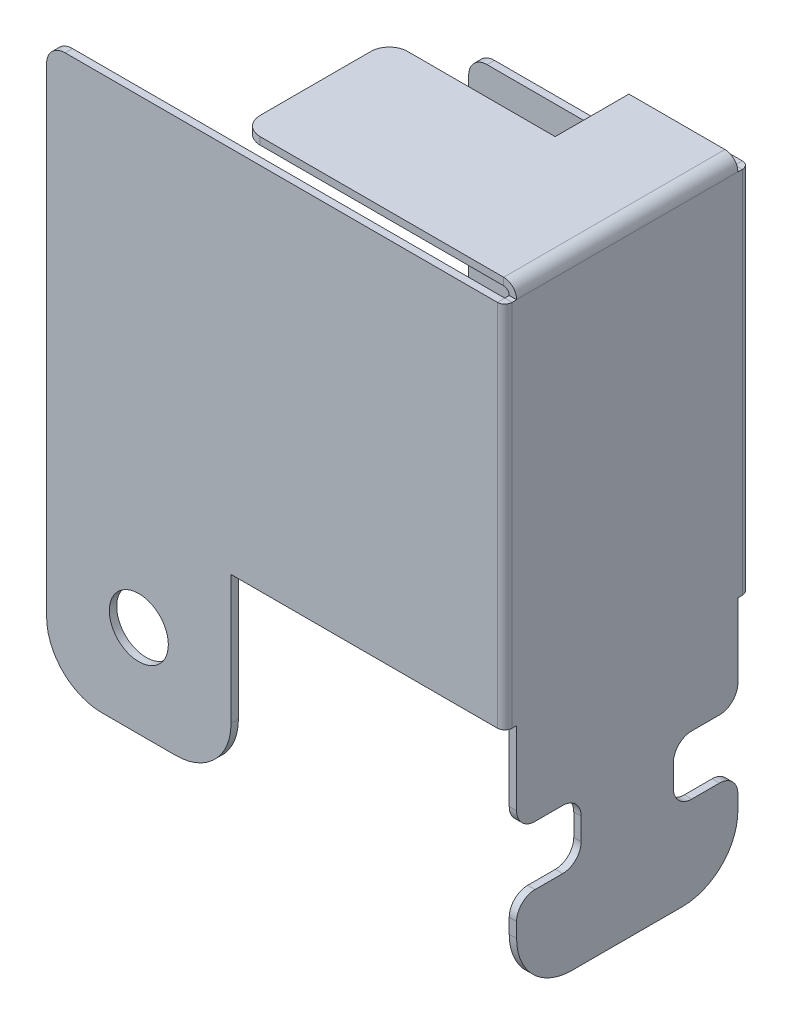
from build123d import *

# Parameters (mm, degrees)
SKETCH1_R                   = 1.6
BASE_FLANGE1_DEPTH          = 0.4
SKETCHED_START              = 45.702497433
SKETCHED_BEND8_DEPTH        = 12
SKETCHED_BEND8_2_DEPTH      = 8
SKETCHED_START_2            = 53.702497433
SKETCHED_BEND8_3_DEPTH      = 4
SKETCHED_START_3            = -4.042672779
SKETCHED_BEND12_DEPTH       = 33.707300919
SKETCHED_START_4            = 8.957327221
SKETCHED_BEND12_2_DEPTH     = 18
SKETCHED_START_5            = 3.957327221
SKETCHED_BEND12_3_OUTLINE_W = 0.4
SKETCHED_BEND12_3_OUTLINE_H = 12
SKETCHED_BEND12_3_DEPTH     = 25.007300919
SKETCHED_BEND12_4_OUTLINE_W = 0.4
SKETCHED_BEND12_4_OUTLINE_H = 12
SKETCHED_BEND12_4_DEPTH     = 4.8
SKETCHED_START_6            = 0.757327221
SKETCHED_BEND12_5_OUTLINE_W = 0.4
SKETCHED_BEND12_5_OUTLINE_H = 5
SKETCHED_BEND12_5_DEPTH     = 3.2
SKETCHED_START_7            = 26.957327221
SKETCHED_BEND12_6_DEPTH     = 2
SKETCHED_START_8            = -8.643134969
SKETCHED_BEND12_7_DEPTH     = 8
SKETCHED_START_9            = -12.643134969
SKETCHED_BEND12_8_DEPTH     = 4
FILLET1_R                   = 3
FILLET2_R                   = 1
FILLET3_R                   = 1


with BuildPart() as part:
    # Base-Flange1: sheet metal written as solids
    # Sketch1 → Base-Flange1 (new body)
    with BuildSketch(Plane.XY):
        Polygon((30.702497433, -1.042672779), (30.702497433, 8.957327221), (45.702497433, 8.957327221), (45.702497433, 3.957327221), (49.202497433, 3.957327221), (49.202497433, 0.757327221), (45.702497433, 0.757327221), (45.702497433, -4.042672779), (57.702497433, -4.042672779), (57.702497433, 0.757327221), (54.202497433, 0.757327221), (54.202497433, 3.957327221), (57.702497433, 3.957327221), (57.702497433, 8.957327221), (72.702497433, 8.957327221), (72.702497433, 26.957327221), (63.702497433, 26.957327221), (63.702497433, 28.957327221), (57.702497433, 28.957327221), (57.702497433, 34.957327221), (53.702497433, 34.957327221), (53.702497433, 43.957327221), (45.702497433, 43.957327221), (45.702497433, 28.957327221), (20.702497433, 28.957327221), (20.702497433, -1.042672779), align=None)
        with Locations((25.702497433, 3.957327221)):
            Circle(SKETCH1_R, mode=Mode.SUBTRACT)
    extrude(amount=-BASE_FLANGE1_DEPTH)

    # Sketched Bend8: read off the stored shape, not the designer's step
    # Sketched Bend8 outline → Sketched Bend8 (cut)
    with BuildSketch(Plane.YZ.offset(SKETCHED_START)):
        with BuildLine():
            ThreePointArc((28.96462814, 0), (29.338793878, -0.108392022), (29.597083672, -0.4))
            Line((29.597083672, -0.4), (43.957327221, -0.4))
            Line((43.957327221, -0.4), (43.957327221, 0))
            Line((43.957327221, 0), (28.96462814, 0))
        make_face()
    extrude(amount=SKETCHED_BEND8_DEPTH, mode=Mode.SUBTRACT)

    # Sketched Bend8 2 outline → Sketched Bend8 2 (add)
    with BuildSketch(Plane.YZ.offset(SKETCHED_START)):
        with BuildLine():
            Line((29.26462814, -14.907300918), (29.66462814, -14.907300918))
            Line((29.66462814, -14.907300918), (29.66462814, -0.7))
            ThreePointArc((29.66462814, -0.7), (29.647533284, -0.546245118), (29.597083672, -0.4))
            Line((29.597083672, -0.4), (28.96462814, -0.4))
            ThreePointArc((28.96462814, -0.4), (29.176760174, -0.487867966), (29.26462814, -0.7))
            Line((29.26462814, -0.7), (29.26462814, -14.907300918))
        make_face()
    extrude(amount=SKETCHED_BEND8_2_DEPTH)

    # Sketched Bend8 3 outline → Sketched Bend8 3 (add)
    with BuildSketch(Plane.YZ.offset(SKETCHED_START_2)):
        with BuildLine():
            Line((29.26462814, -0.7), (29.26462814, -5.907300918))
            Line((29.26462814, -5.907300918), (29.66462814, -5.907300918))
            Line((29.66462814, -5.907300918), (29.66462814, -0.7))
            ThreePointArc((29.66462814, -0.7), (29.647533284, -0.546245118), (29.597083672, -0.4))
            Line((29.597083672, -0.4), (28.96462814, -0.4))
            ThreePointArc((28.96462814, -0.4), (29.176760174, -0.487867966), (29.26462814, -0.7))
        make_face()
    extrude(amount=SKETCHED_BEND8_3_DEPTH)

    # Sketched Bend12: read off the stored shape, not the designer's step
    # Sketched Bend12 outline → Sketched Bend12 (cut)
    with BuildSketch(Plane(origin=(0, 0, 0), x_dir=(1, 0, 0), z_dir=(0, 1, 0)).offset(SKETCHED_START_3)):
        with BuildLine():
            Line((45.702497433, 0.4), (45.545631155, 0.4))
            ThreePointArc((45.545631155, 0.4), (45.427828447, 0.117096847), (45.144632402, 0))
            Line((45.144632402, 0), (72.702497433, 0))
            Line((72.702497433, 0), (72.702497433, 0.4))
            Line((72.702497433, 0.4), (57.702497433, 0.4))
            Line((57.702497433, 0.4), (57.702497433, 5.907300918))
            Line((57.702497433, 5.907300918), (53.702497433, 5.907300918))
            Line((53.702497433, 5.907300918), (53.702497433, 14.907300918))
            Line((53.702497433, 14.907300918), (45.702497433, 14.907300918))
            Line((45.702497433, 14.907300918), (45.702497433, 0.4))
        make_face()
    extrude(amount=SKETCHED_BEND12_DEPTH, mode=Mode.SUBTRACT)

    # Sketched Bend12 2 outline → Sketched Bend12 2 (add)
    with BuildSketch(Plane(origin=(0, 0, 0), x_dir=(1, 0, 0), z_dir=(0, 1, 0)).offset(SKETCHED_START_4)):
        with BuildLine():
            ThreePointArc((45.145632402, 0.401), (45.145339509, 0.400292893), (45.144632402, 0.4))
            Line((45.144632402, 0.4), (45.545631155, 0.4))
            ThreePointArc((45.545631155, 0.4), (45.54563209, 0.4005), (45.545632402, 0.401))
            Line((45.545632402, 0.401), (45.545632402, 12.885269938))
            ThreePointArc((45.545632402, 12.885269938), (45.428182222, 13.168819758), (45.144632402, 13.286269938))
            Line((45.144632402, 13.286269938), (30.702497433, 13.286269938))
            Line((30.702497433, 13.286269938), (30.702497433, 12.886269938))
            Line((30.702497433, 12.886269938), (45.144632402, 12.886269938))
            ThreePointArc((45.144632402, 12.886269938), (45.145339509, 12.885977045), (45.145632402, 12.885269938))
            Line((45.145632402, 12.885269938), (45.145632402, 0.401))
        make_face()
    extrude(amount=SKETCHED_BEND12_2_DEPTH)

    # Sketched Bend12 3 outline → Sketched Bend12 3 (add)
    with BuildSketch(Plane(origin=(0, 0, 0), x_dir=(1, 0, 0), z_dir=(0, 1, 0)).offset(SKETCHED_START_5)):
        with Locations((45.345632402, 6.643134969)):
            Rectangle(SKETCHED_BEND12_3_OUTLINE_W, SKETCHED_BEND12_3_OUTLINE_H)
    extrude(amount=SKETCHED_BEND12_3_DEPTH)



with BuildPart() as body_2:
    # Sketched Bend12 4 outline → Sketched Bend12 4 (new body)
    with BuildSketch(Plane(origin=(0, 0, 0), x_dir=(1, 0, 0), z_dir=(0, 1, 0)).offset(SKETCHED_START_3)):
        with Locations((45.345632402, 6.643134969)):
            Rectangle(SKETCHED_BEND12_4_OUTLINE_W, SKETCHED_BEND12_4_OUTLINE_H)
    extrude(amount=SKETCHED_BEND12_4_DEPTH)


with BuildPart() as part_1:
    add(part.part)

    add(body_2.part)  # Sketched Bend12 5 merges body 2
    # Sketched Bend12 5 outline → Sketched Bend12 5 (add)
    with BuildSketch(Plane(origin=(0, 0, 0), x_dir=(1, 0, 0), z_dir=(0, 1, 0)).offset(SKETCHED_START_6)):
        with Locations((45.345632402, 6.643134969)):
            Rectangle(SKETCHED_BEND12_5_OUTLINE_W, SKETCHED_BEND12_5_OUTLINE_H)
    extrude(amount=SKETCHED_BEND12_5_DEPTH)

    # Sketched Bend12 6 outline → Sketched Bend12 6 (add)
    with BuildSketch(Plane(origin=(0, 0, 0), x_dir=(1, 0, 0), z_dir=(0, 1, 0)).offset(SKETCHED_START_7)):
        with BuildLine():
            Line((45.145632402, 0.643134969), (45.145632402, 0.401))
            ThreePointArc((45.145632402, 0.401), (45.145339509, 0.400292893), (45.144632402, 0.4))
            Line((45.144632402, 0.4), (45.545631155, 0.4))
            ThreePointArc((45.545631155, 0.4), (45.54563209, 0.4005), (45.545632402, 0.401))
            Line((45.545632402, 0.401), (45.545632402, 0.643134969))
            Line((45.545632402, 0.643134969), (45.145632402, 0.643134969))
        make_face()
        with BuildLine():
            Line((45.145632402, 12.885269938), (45.145632402, 12.643134969))
            Line((45.145632402, 12.643134969), (45.545632402, 12.643134969))
            Line((45.545632402, 12.643134969), (45.545632402, 12.885269938))
            ThreePointArc((45.545632402, 12.885269938), (45.428182222, 13.168819758), (45.144632402, 13.286269938))
            Line((45.144632402, 13.286269938), (39.702497433, 13.286269938))
            Line((39.702497433, 13.286269938), (39.702497433, 12.886269938))
            Line((39.702497433, 12.886269938), (45.144632402, 12.886269938))
            ThreePointArc((45.144632402, 12.886269938), (45.145339509, 12.885977045), (45.145632402, 12.885269938))
        make_face()
    extrude(amount=SKETCHED_BEND12_6_DEPTH)

    # Sketched Bend12 7 outline → Sketched Bend12 7 (add)
    with BuildSketch(Plane.XY.offset(SKETCHED_START_8)):
        with BuildLine():
            ThreePointArc((44.845632402, 29.26462814), (45.057764437, 29.176760175), (45.145632402, 28.96462814))
            Line((45.145632402, 28.96462814), (45.545632402, 28.96462814))
            ThreePointArc((45.545632402, 28.96462814), (45.340607148, 29.459602887), (44.845632402, 29.66462814))
            Line((44.845632402, 29.66462814), (30.638331484, 29.66462814))
            Line((30.638331484, 29.66462814), (30.638331484, 29.26462814))
            Line((30.638331484, 29.26462814), (44.845632402, 29.26462814))
        make_face()
    extrude(amount=SKETCHED_BEND12_7_DEPTH)

    # Sketched Bend12 8 outline → Sketched Bend12 8 (add)
    with BuildSketch(Plane.XY.offset(SKETCHED_START_9)):
        with BuildLine():
            Line((39.638331484, 29.26462814), (44.845632402, 29.26462814))
            ThreePointArc((44.845632402, 29.26462814), (45.057764437, 29.176760175), (45.145632402, 28.96462814))
            Line((45.145632402, 28.96462814), (45.545632402, 28.96462814))
            ThreePointArc((45.545632402, 28.96462814), (45.340607148, 29.459602887), (44.845632402, 29.66462814))
            Line((44.845632402, 29.66462814), (39.638331484, 29.66462814))
            Line((39.638331484, 29.66462814), (39.638331484, 29.26462814))
        make_face()
    extrude(amount=SKETCHED_BEND12_8_DEPTH)

    # Fillet1
    fillet1_edges = [part_1.edges().sort_by_distance(p)[0] for p in [
        (45.345632402, -4.042672779, -0.643134969),
        (45.345632402, -4.042672779, -12.643134969),
        (20.702497433, -1.042672779, -0.2),
        (30.702497433, -1.042672779, -0.2),
    ]]
    fillet(fillet1_edges, radius=FILLET1_R)

    # Fillet2
    fillet2_edges = [part_1.edges().sort_by_distance(p)[0] for p in [
        (20.702497433, 28.957327221, -0.2),
        (30.702497433, 26.957327221, -13.086269938),
        (30.702497433, 8.957327221, -13.086269938),
        (30.638331484, 29.46462814, -0.643134969),
        (30.638331484, 29.46462814, -8.643134969),
    ]]
    fillet(fillet2_edges, radius=FILLET2_R)

    # Fillet3
    fillet3_edges = [part_1.edges().sort_by_distance(p)[0] for p in [
        (45.345632402, 3.957327221, -0.643134969),
        (45.345632402, 3.957327221, -4.143134969),
        (45.345632402, 0.757327221, -4.143134969),
        (45.345632402, 0.757327221, -0.643134969),
        (45.345632402, 0.757327221, -12.643134969),
        (45.345632402, 0.757327221, -9.143134969),
        (45.345632402, 3.957327221, -9.143134969),
        (45.345632402, 3.957327221, -12.643134969),
    ]]
    fillet(fillet3_edges, radius=FILLET3_R)


solid = part_1.part
